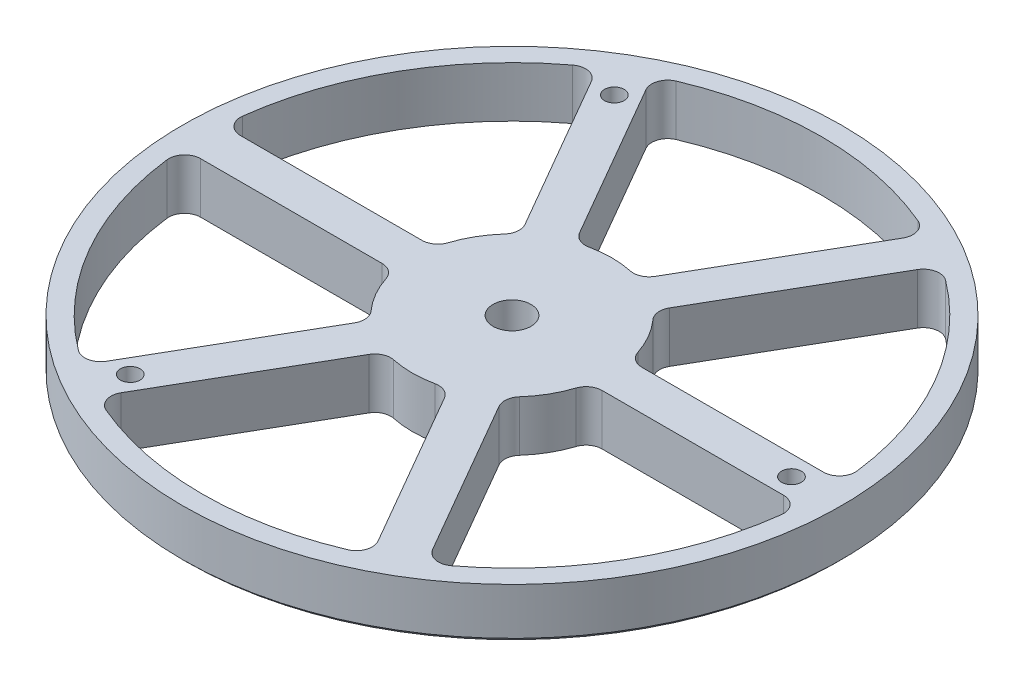
from build123d import *

# Parameters (mm, degrees)
F_10_0_1935_DIAMETER_HOLE1_D = 4.9149
CIRPATTERN3_COUNT            = 3
CUT_EXTRUDE1_DEPTH           = 118.43208675655899
FILLET1_R                    = 4
CIRPATTERN4_COUNT            = 6
FILLET1_OF_CIRPATTERN4_R     = 4
CHAMFER2_SIZE                = 1
F_3_8_0_375_DIAMETER_HOLE1_D = 9.525


with BuildPart() as part:
    # Sketch2 → Revolve1 (revolve)
    with BuildSketch(Plane(origin=(0, 0, 0), x_dir=(0, 0, -1), z_dir=(1, 0, 0))):
        Polygon((0, 0), (-82.55, -1.011e-14), (-82.55, 12.699999999999989), (0, 12.699999999999989), align=None)
    revolve(axis=Axis((0, -0.6350000000000106, 0), (0, 1, 0)))

    # #10 (0.1935) Diameter Hole1 (through all)
    with Locations(Plane(origin=(0, 12.699999999999989, 0), x_dir=(1, 0, 0), z_dir=(0, 1, 0))):
        with Locations((-35, 60.621778265)):
            f_10_0_1935_diameter_hole1 = Hole(F_10_0_1935_DIAMETER_HOLE1_D / 2)

    # CirPattern3: #10 (0.1935) Diameter Hole1 ×3 about axis
    cirpattern3_axis = Axis((0, -0.6350000000000106, 0), (0, 1, 0))
    for i in range(1, CIRPATTERN3_COUNT):
        add(f_10_0_1935_diameter_hole1.rotate(cirpattern3_axis, i * 360 / CIRPATTERN3_COUNT), mode=Mode.SUBTRACT)

    # Sketch8 → Cut-Extrude1 (cut, through all)
    with BuildSketch(Plane(origin=(0, 12.699999999999989, 0), x_dir=(1, 0, 0), z_dir=(0, 1, 0))):
        with BuildLine():
            Line((-7.91732169499373, 23.713203435596423), (-34.36419588509058, 69.52053323422602))
            ThreePointArc((-34.36419588509058, 69.52053323422602), (4.75e-15, 77.55000000000001), (34.36419588509058, 69.52053323422602))
            Line((34.36419588509058, 69.52053323422602), (7.917321694993729, 23.713203435596423))
            ThreePointArc((7.917321694993729, 23.713203435596423), (1.53e-15, 25.000000000000007), (-7.91732169499373, 23.713203435596423))
        make_face()
    cut_extrude1 = extrude(amount=-CUT_EXTRUDE1_DEPTH, mode=Mode.SUBTRACT)

    # Fillet1
    fillet1_edges = [part.edges().sort_by_distance(p)[0] for p in [
        (7.9173216949937295, 6.349999999999994, -23.713203435596427),
        (34.36419588509058, 6.349999999999994, -69.52053323422604),
        (-7.9173216949937295, 6.349999999999994, -23.713203435596427),
        (-34.36419588509058, 6.349999999999994, -69.52053323422604),
    ]]
    fillet(fillet1_edges, radius=FILLET1_R)

    # CirPattern4: Cut-Extrude1 ×6 about axis
    cirpattern4_axis = Axis((0, -0.6350000000000106, 0), (0, 1, 0))
    for i in range(1, CIRPATTERN4_COUNT):
        add(cut_extrude1.rotate(cirpattern4_axis, i * 360 / CIRPATTERN4_COUNT), mode=Mode.SUBTRACT)

    # Fillet1 of CirPattern4
    fillet1_of_cirpattern4_edges = [part.edges().sort_by_distance(p)[0] for p in [
        (-16.577575732838067, 6.349999999999994, -18.713203435596455),
        (-43.02444992293479, 6.349999999999994, -64.52053323422614),
        (-24.4948974278318, 6.349999999999994, -4.999999999999974),
        (-77.38864580802537, 6.349999999999994, -4.999999999999911),
        (-24.494897427831795, 6.349999999999994, 4.999999999999966),
        (-77.38864580802539, 6.349999999999994, 4.999999999999886),
        (-16.57757573283807, 6.349999999999994, 18.713203435596448),
        (-43.024449922934814, 6.349999999999994, 64.52053323422612),
        (-7.917321694993732, 6.349999999999994, 23.713203435596427),
        (-34.36419588509059, 6.349999999999994, 69.52053323422604),
        (7.917321694993727, 6.349999999999994, 23.713203435596427),
        (34.364195885090574, 6.349999999999994, 69.52053323422604),
        (16.577575732838056, 6.349999999999994, 18.713203435596462),
        (43.024449922934764, 6.349999999999994, 64.52053323422615),
        (24.494897427831795, 6.349999999999994, 4.999999999999985),
        (77.38864580802537, 6.349999999999994, 4.99999999999994),
        (24.4948974278318, 6.349999999999994, -4.999999999999974),
        (77.38864580802537, 6.349999999999994, -4.999999999999911),
        (16.577575732838067, 6.349999999999994, -18.713203435596455),
        (43.02444992293479, 6.349999999999994, -64.52053323422614),
    ]]
    fillet(fillet1_of_cirpattern4_edges, radius=FILLET1_OF_CIRPATTERN4_R)

    # Chamfer2
    chamfer2_edges = [part.edges().sort_by_distance(p)[0] for p in [
        (4.677e-14, -1.01e-14, -82.55),
    ]]
    chamfer(chamfer2_edges, length=CHAMFER2_SIZE)

    # 3/8 (0.375) Diameter Hole1 (through all)
    with Locations(Plane(origin=(0, 0, 0), x_dir=(-1, 0, 0), z_dir=(0, -1, 0))):
        with Locations((0, 0)):
            Hole(F_3_8_0_375_DIAMETER_HOLE1_D / 2)


solid = part.part
